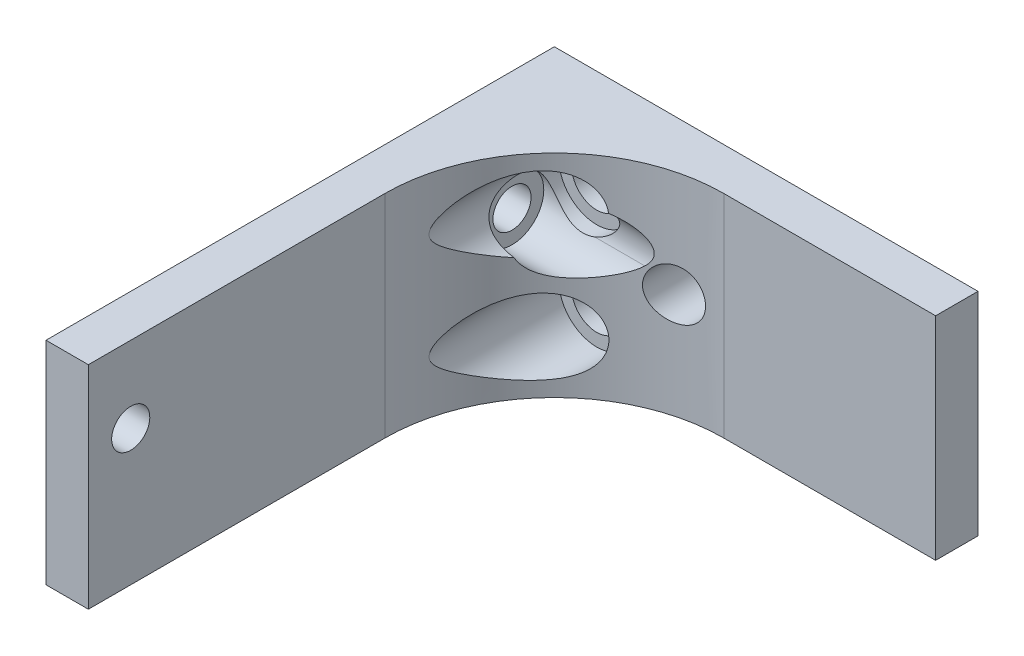
from build123d import *

# Parameters (mm, degrees)
CROQUIS1_W                   = 50
CROQUIS1_H                   = 25
CROQUIS1_R                   = 2.95
SALIENTE_EXTRUIR1_DEPTH      = 5
CROQUIS1_3_W                 = 5
CROQUIS1_3_H                 = 25
SALIENTE_EXTRUIR2_DEPTH      = 60
REDONDEO2_DEPTH              = 25
REDONDEO2_START              = 5
REDONDEO2_2_OUTLINE_R        = 2.95
REDONDEO2_2_DEPTH            = 20
CROQUIS4_R                   = 4.45
CORTAR_EXTRUIR1_DEPTH        = 79.421935739
CROQUIS5_R                   = 2.25
CORTAR_EXTRUIR2_DEPTH        = 80.056941536
CROQUIS5_3_R                 = 3.75
CROQUIS5_3_R_2               = 2.25
CORTAR_EXTRUIR_L_MINA3_DEPTH = 80.056941536


with BuildPart() as part:
    # Croquis1 → Saliente-Extruir1 (new body)
    with BuildSketch(Plane.XY):
        with Locations((25, 12.5)):
            Rectangle(CROQUIS1_W, CROQUIS1_H)
        with Locations((10, 18.75)):
            Circle(CROQUIS1_R, mode=Mode.SUBTRACT)
        with Locations((10, 6.25)):
            Circle(CROQUIS1_R, mode=Mode.SUBTRACT)
        with Locations((20, 12.5)):
            Circle(CROQUIS1_R, mode=Mode.SUBTRACT)
    extrude(amount=SALIENTE_EXTRUIR1_DEPTH)

    # Croquis1<3> → Saliente-Extruir2 (add)
    with BuildSketch(Plane.XY):
        with Locations((2.5, 12.5)):
            Rectangle(CROQUIS1_3_W, CROQUIS1_3_H)
    extrude(amount=SALIENTE_EXTRUIR2_DEPTH)

    # Redondeo2: read off the stored shape, not the designer's step
    # Redondeo2 outline → Redondeo2 (add)
    with BuildSketch(Plane(origin=(0, 0, 0), x_dir=(1, 0, 0), z_dir=(0, 1, 0))):
        with BuildLine():
            Line((5, -5), (5, -25))
            ThreePointArc((5, -25), (10.857864376, -10.857864376), (25, -5))
            Line((25, -5), (5, -5))
        make_face()
    extrude(amount=REDONDEO2_DEPTH)

    # Redondeo2 2 outline → Redondeo2 2 (cut)
    with BuildSketch(Plane.XY.offset(REDONDEO2_START)):
        with Locations((10, 18.75)):
            Circle(REDONDEO2_2_OUTLINE_R)
        with Locations((20, 12.5)):
            Circle(REDONDEO2_2_OUTLINE_R)
        with Locations((10, 6.25)):
            Circle(REDONDEO2_2_OUTLINE_R)
    extrude(amount=REDONDEO2_2_DEPTH, mode=Mode.SUBTRACT)

    # Croquis4 → Cortar-Extruir1 (cut, through all)
    with BuildSketch(Plane.XY.offset(5)):
        with Locations(Location((10, 18.75, 0), (0, 0, 180))):
            Circle(CROQUIS4_R)
        with Locations(Location((10, 6.25, 0), (0, 0, 180))):
            Circle(CROQUIS4_R)
    extrude(amount=CORTAR_EXTRUIR1_DEPTH, mode=Mode.SUBTRACT)

    # Croquis5 → Cortar-Extruir2 (cut, through all)
    with BuildSketch(Plane(origin=(5, 0, 0), x_dir=(0, 0, -1), z_dir=(1, 0, 0))):
        with Locations(Location((-55, 16, 0), (0, 0, 90))):
            Circle(CROQUIS5_R)
        with Locations(Location((-10, 16, 0), (0, 0, 90))):
            Circle(CROQUIS5_R)
    extrude(amount=-CORTAR_EXTRUIR2_DEPTH, mode=Mode.SUBTRACT)

    # Croquis5<3> → Cortar-Extruir-Lámina3 (cut, through all)
    with BuildSketch(Plane(origin=(5, 0, 0), x_dir=(0, 0, -1), z_dir=(1, 0, 0))):
        with Locations((-10, 16)):
            Circle(CROQUIS5_3_R)
        with Locations((-10, 16)):
            Circle(CROQUIS5_3_R_2, mode=Mode.SUBTRACT)
    extrude(amount=CORTAR_EXTRUIR_L_MINA3_DEPTH, mode=Mode.SUBTRACT)


with BuildPart() as cortar_extruir_l_mina3_kept_piece:
    # of the separate pieces the step leaves, the one the design keeps (cortar_extruir_l_mina3_pieces_kept)
    add(part.part.solids().sort_by_distance((0, 0, 0))[0])


solid = cortar_extruir_l_mina3_kept_piece.part
